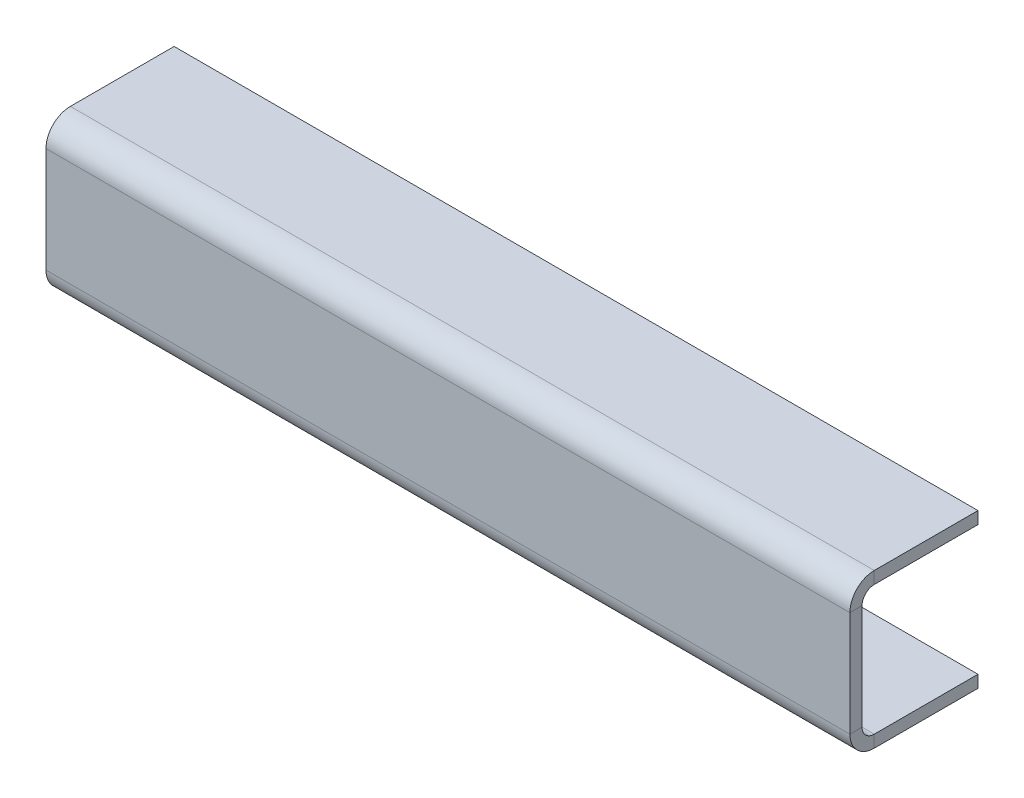
from build123d import *

# Parameters (mm, degrees)
BASE_FLANGE1_DEPTH = 209.55


# Sheet-metal steps are written as plain solids
with BuildPart() as part:
    # Sketch1 → Base-Flange1 (new body)
    with BuildSketch(Plane(origin=(0, 0, 0), x_dir=(0, 0, -1), z_dir=(1, 0, 0))):
        with BuildLine():
            Line((30.226, 33.782), (3.175, 33.782))
            ThreePointArc((3.175, 33.782), (0.92993597, 32.85206403), (0, 30.607))
            Line((0, 30.607), (0, 3.175))
            ThreePointArc((0, 3.175), (0.92993597, 0.92993597), (3.175, 0))
            Line((3.175, 0), (30.226, 0))
            Line((30.226, 0), (30.226, -3.175))
            Line((30.226, -3.175), (3.175, -3.175))
            ThreePointArc((3.175, -3.175), (-1.315128061, -1.315128061), (-3.175, 3.175))
            Line((-3.175, 3.175), (-3.175, 30.607))
            ThreePointArc((-3.175, 30.607), (-1.315128061, 35.097128061), (3.175, 36.957))
            Line((3.175, 36.957), (30.226, 36.957))
            Line((30.226, 36.957), (30.226, 33.782))
        make_face()
    extrude(amount=BASE_FLANGE1_DEPTH)


solid = part.part
